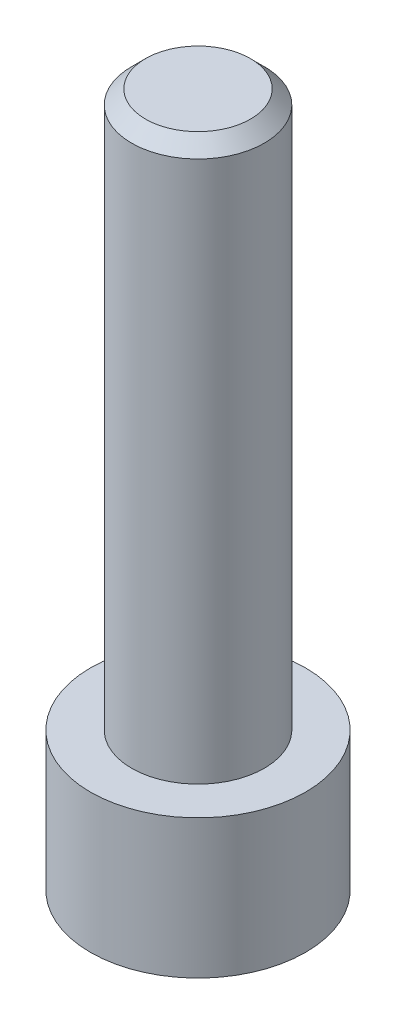
from build123d import *

# Parameters (mm, degrees)
SKETCH1_R           = 3.875
BOSS_EXTRUDE1_DEPTH = 25
SKETCH2_OUTSIDE_W   = 15.21
SKETCH2_OUTSIDE_H   = 15.21
SKETCH2_OUTSIDE_R   = 2.39
CUT_EXTRUDE1_DEPTH  = 20
CHAMFER1_SIZE       = 0.5
CUT_EXTRUDE2_DEPTH  = 3.36


with BuildPart() as part:
    # Sketch1 → Boss-Extrude1 (new body)
    with BuildSketch(Plane(origin=(0, 0, 0), x_dir=(1, 0, 0), z_dir=(0, 1, 0))):
        Circle(SKETCH1_R)
    extrude(amount=BOSS_EXTRUDE1_DEPTH)

    # Sketch2 outside → Cut-Extrude1 (cut)
    with BuildSketch(Plane(origin=(0, 25, 0), x_dir=(1, 0, 0), z_dir=(0, 1, 0))):
        Rectangle(SKETCH2_OUTSIDE_W, SKETCH2_OUTSIDE_H)
        Circle(SKETCH2_OUTSIDE_R, mode=Mode.SUBTRACT)
    extrude(amount=-CUT_EXTRUDE1_DEPTH, mode=Mode.SUBTRACT)

    # Chamfer1
    chamfer1_edges = [part.edges().sort_by_distance(p)[0] for p in [
        (-2.39, 25, 0),
    ]]
    chamfer(chamfer1_edges, length=CHAMFER1_SIZE)

    # Sketch8 → Cut-Extrude2 (cut)
    with BuildSketch(Plane.XZ):
        Polygon((2.644264233, 0), (1.322132116, 2.29), (-1.322132116, 2.29), (-2.644264233, 0), (-1.322132116, -2.29), (1.322132116, -2.29), align=None)
    extrude(amount=-CUT_EXTRUDE2_DEPTH, mode=Mode.SUBTRACT)


solid = part.part
